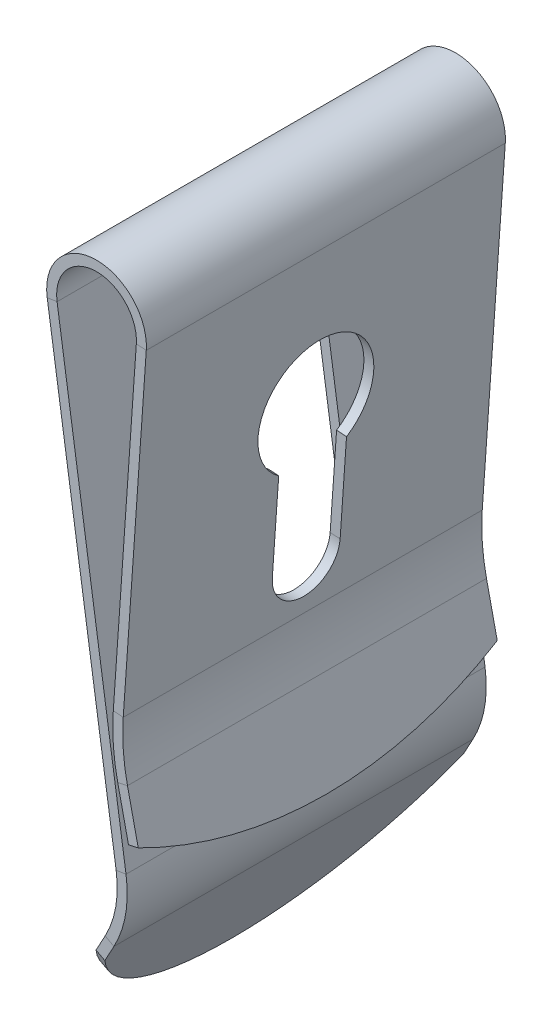
from build123d import *

# Parameters (mm, degrees)
TABAN_FLAN_1_DEPTH           = 9
KENAR_FLAN_1_STRIP_CUT_DEPTH = 18
KENAR_FLAN_1_DEPTH           = 18
KENAR_FLAN_1_START           = 0.5
KENAR_FLAN_1_FLAT_DEPTH      = 0.5
DIKI_1_START                 = -9
DIKI_1_DEPTH                 = 18
IZIM24_W                     = 18
IZIM24_H                     = 7
SEKME3_DEPTH                 = 0.5
KENAR_FLAN_2_STRIP_CUT_DEPTH = 18
KENAR_FLAN_2_DEPTH           = 18
KENAR_FLAN_2_START           = 0.5
KENAR_FLAN_2_FLAT_DEPTH      = 0.5
KES_EKSTR_ZYON1_REACH        = 24.729
KES_EKSTR_ZYON2_REACH        = 24.841


# Read off the part's stored shape, not the designer's step: Dikiş1
# Sheet-metal steps are written as plain solids
with BuildPart() as part:
    # Çizim1 → Taban-Flanş1 (new, symmetric)
    with BuildSketch(Plane.XY):
        Polygon((0, 0), (1.255616527, 17.956152905), (1.754398553, 17.921274668), (0.498782025, -0.034878237), align=None)
    extrude(amount=TABAN_FLAN_1_DEPTH, both=True)

    # Kenar-Flanş1 strip (across the edge) → Kenar-Flanş1 strip cut (cut)
    with BuildSketch(Plane(origin=(0.498782025, -0.034878237, 9), x_dir=(0.9762960071199348, 0.2164396139380966, 0), z_dir=(0, 0, -1))):
        Polygon((-6.3159448, 19.561804043), (-0.067607216, -1.532230124), (0.411802651, -1.390222452), (-5.836534932, 19.703811715), align=None)
    extrude(amount=KENAR_FLAN_1_STRIP_CUT_DEPTH, mode=Mode.SUBTRACT)

    # Kenar-Flanş1 bend section (across the edge) → Kenar-Flanş1 (add)
    with BuildSketch(Plane(origin=(0.498782025, -0.034878237, 9), x_dir=(0.9762960071199348, 0.2164396139380966, 0), z_dir=(0, 0, -1))):
        with BuildLine():
            Line((-0.5, 1.449930995), (0, 1.449930995))
            ThreePointArc((0, 1.449930995), (0.103486132, 0.015004775), (0.411802651, -1.390222452))
            Line((0.411802651, -1.390222452), (-0.067607216, -1.532230124))
            ThreePointArc((-0.067607216, -1.532230124), (-0.391339562, -0.056741536), (-0.5, 1.449930995))
        make_face()
    extrude(amount=KENAR_FLAN_1_DEPTH)

    # Kenar-Flanş1 profile (on flange) → Kenar-Flanş1 flat (add)
    with BuildSketch(Plane(origin=(0.498782025, -0.034878237, 0), x_dir=(0, 0, -1), z_dir=(-0.9762960071199348, -0.2164396139380966, 0)).offset(KENAR_FLAN_1_START)):
        with BuildLine():
            ThreePointArc((9, 3.9408211), (0, 5.9408211), (-9, 3.9408211))
            Line((-9, 3.9408211), (-9, 1.449930995))
            Line((-9, 1.449930995), (9, 1.449930995))
            Line((9, 1.449930995), (9, 3.9408211))
        make_face()
    extrude(amount=-KENAR_FLAN_1_FLAT_DEPTH)

    # Dikiş1 outline → Dikiş1 (add)
    with BuildSketch(Plane.XY.offset(DIKI_1_START)):
        with BuildLine():
            Line((-0.542336916, -0.13733327), (-0.047828985, -0.063428564))
            Line((-0.047828985, -0.063428564), (-2.7175433, 17.80004703))
            ThreePointArc((-2.7175433, 17.80004703), (-0.818031205, 20.094123925), (1.255616527, 17.956152905))
            Line((1.255616527, 17.956152905), (1.754398553, 17.921274668))
            ThreePointArc((1.754398553, 17.921274668), (-0.837661113, 20.593738443), (-3.212051232, 17.726142324))
            Line((-3.212051232, 17.726142324), (-0.542336916, -0.13733327))
        make_face()
    extrude(amount=DIKI_1_DEPTH)

    # Çizim24 → Sekme3 (add)
    with BuildSketch(Plane(origin=(-0.550564326, -0.08228239, 0), x_dir=(0, 0, 1), z_dir=(-0.989015863361916, -0.1478094111296166, 0))):
        with Locations((0, -3.555662282)):
            Rectangle(IZIM24_W, IZIM24_H)
    extrude(amount=-SEKME3_DEPTH)

    # Kenar-Flanş2 strip (across the edge) → Kenar-Flanş2 strip cut (cut)
    with BuildSketch(Plane(origin=(0.492328961, -7.060444313, -9), x_dir=(-0.8788171126619707, 0.4771587602595987, 0), z_dir=(0, 0, 1))):
        Polygon((-6.614275583, 7.946620091), (0.607504695, -1.63700603), (1.00682245, -1.336098518), (-6.214957828, 8.247527602), align=None)
    extrude(amount=KENAR_FLAN_2_STRIP_CUT_DEPTH, mode=Mode.SUBTRACT)

    # Kenar-Flanş2 bend section (across the edge) → Kenar-Flanş2 (add)
    with BuildSketch(Plane(origin=(0.492328961, -7.060444313, -9), x_dir=(-0.8788171126619707, 0.4771587602595987, 0), z_dir=(0, 0, 1))):
        with BuildLine():
            Line((-0.5, 1.672976598), (0, 1.672976598))
            ThreePointArc((0, 1.672976598), (0.258381724, 0.086453315), (1.00682245, -1.336098518))
            Line((1.00682245, -1.336098518), (0.607504695, -1.63700603))
            ThreePointArc((0.607504695, -1.63700603), (-0.215780104, -0.072199013), (-0.5, 1.672976598))
        make_face()
    extrude(amount=KENAR_FLAN_2_DEPTH)

    # Kenar-Flanş2 profile (on flange) → Kenar-Flanş2 flat (add)
    with BuildSketch(Plane(origin=(0.492328961, -7.060444313, 0), x_dir=(0, 0, 1), z_dir=(0.8788171126619707, -0.4771587602595987, 0)).offset(KENAR_FLAN_2_START)):
        with BuildLine():
            ThreePointArc((9, 2.63270234), (0, 8.13270234), (-9, 2.63270234))
            Line((-9, 2.63270234), (-9, 1.672976598))
            Line((-9, 1.672976598), (9, 1.672976598))
            Line((9, 1.672976598), (9, 2.63270234))
        make_face()
    extrude(amount=-KENAR_FLAN_2_FLAT_DEPTH)

    # Çizim31 → Kes-Ekstrüzyon1 (cut, up to next)
    with BuildSketch(Plane(origin=(-0.550564326, -0.08228239, 0), x_dir=(0, 0, 1), z_dir=(-0.9890158633619159, -0.1478094111296166, 0)), mode=Mode.PRIVATE) as kes_ekstr_zyon1_sk1:
        with BuildLine():
            Line((-3.55, 10.956207356), (-3.55, 4.156207356))
            ThreePointArc((-3.55, 4.156207356), (0, 0.606207356), (3.55, 4.156207356))
            Line((3.55, 4.156207356), (3.55, 10.956207356))
            ThreePointArc((3.55, 10.956207356), (0, 14.506207356), (-3.55, 10.956207356))
        make_face()
    kes_ekstr_zyon1_tool1 = extrude(kes_ekstr_zyon1_sk1.sketch, amount=-KES_EKSTR_ZYON1_REACH, mode=Mode.PRIVATE) & part.part
    add(kes_ekstr_zyon1_tool1.solids().sort_by_distance((-1.667443, 7.390927, 0))[0], mode=Mode.SUBTRACT)

    # Çizim32 → Kes-Ekstrüzyon2 (cut, up to next)
    with BuildSketch(Plane(origin=(0.498782025, -0.034878237, 0), x_dir=(0, 0, -1), z_dir=(0.9975640502598243, -0.06975647374412548, 0)), mode=Mode.PRIVATE) as kes_ekstr_zyon2_sk1:
        with BuildLine():
            Line((1.7, 8.550531975), (1.7, 3.937201267))
            ThreePointArc((1.7, 3.937201267), (0, 2.237201267), (-1.7, 3.937201267))
            Line((-1.7, 3.937201267), (-1.7, 8.550531975))
            ThreePointArc((-1.7, 8.550531975), (0, 13.8), (1.7, 8.550531975))
        make_face()
    kes_ekstr_zyon2_tool1 = extrude(kes_ekstr_zyon2_sk1.sketch, amount=-KES_EKSTR_ZYON2_REACH, mode=Mode.PRIVATE) & part.part
    add(kes_ekstr_zyon2_tool1.solids().sort_by_distance((1.098249, 8.537894, 0))[0], mode=Mode.SUBTRACT)


solid = part.part
